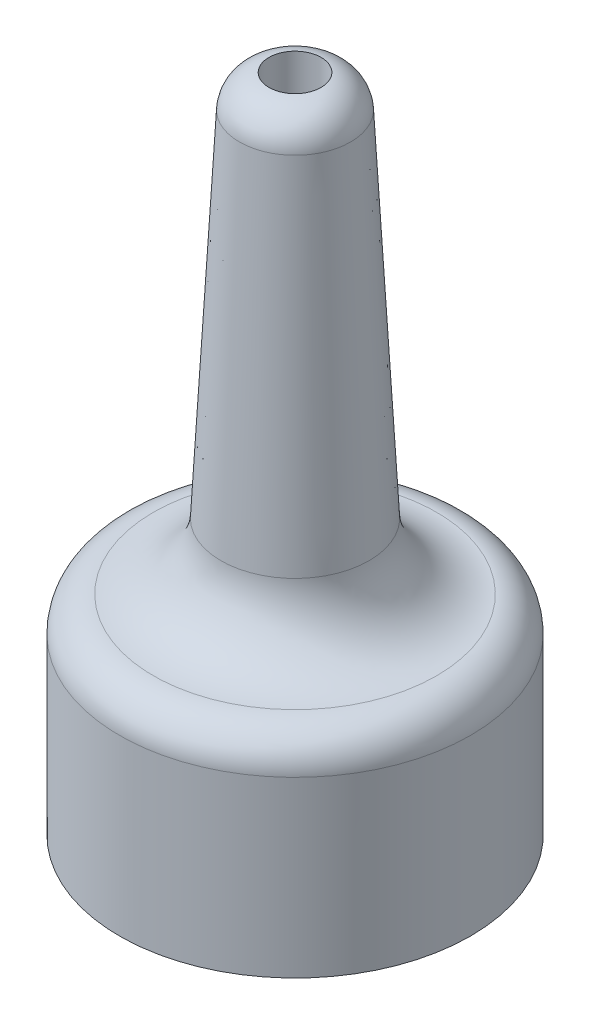
from build123d import *

# Parameters (mm, degrees)
FILLET2_R = 2
FILLET3_R = 1
FILLET4_R = 1


with BuildPart() as part:
    # Sketch2 → Revolve1 (revolve)
    with BuildSketch(Plane.XY, mode=Mode.PRIVATE) as revolve1_sk:
        Polygon((-1.55, 12.982183952), (-2.230367431, 0), (-5.05, 0), (-5.05, -6), (-3.95, -6), (-3.95, -1), (-0.75, -1), (-0.75, 13), align=None)
    revolve(revolve1_sk.sketch.rotate(Axis((0, -1000, 0), (0, 1, 0)), 180), axis=Axis((0, -1000, 0), (0, 1, 0)))

    # Fillet2
    fillet2_edges = [part.edges().sort_by_distance(p)[0] for p in [
        (-2.230367431, 0, 0),
    ]]
    fillet(fillet2_edges, radius=FILLET2_R)

    # Fillet3
    fillet3_edges = [part.edges().sort_by_distance(p)[0] for p in [
        (-5.05, 0, 0),
    ]]
    fillet(fillet3_edges, radius=FILLET3_R)

    # Fillet4
    # the kernel refuses this fillet: 1 mm, written as the material it takes off along each edge
    with BuildSketch(Plane(origin=(0, 12.982183952, 0), x_dir=(1, 0, 0), z_dir=(0, 0, 1))) as fillet4_piece_1:
        with BuildLine():
            CenterArc((0.599504848, -0.970794699), FILLET4_R, 3, 78.344377595)
            Line((0.75, 0.017816048), (0.753009903, 0.037588263))
            ThreePointArc((0.753009903, 0.037588263), (1.150445291, 0.028903066), (1.550445291, 0.019995042))
            Line((1.550445291, 0.019995042), (1.569972591, 0.001046719))
            Line((1.569972591, 0.001046719), (1.618106974, -0.917412024))
            Line((1.618106974, -0.917412024), (1.598134383, -0.918458743))
        make_face()
    revolve(axis=Axis((0, 12.982183952, 0), (0, 1, 0)), mode=Mode.SUBTRACT)


solid = part.part
